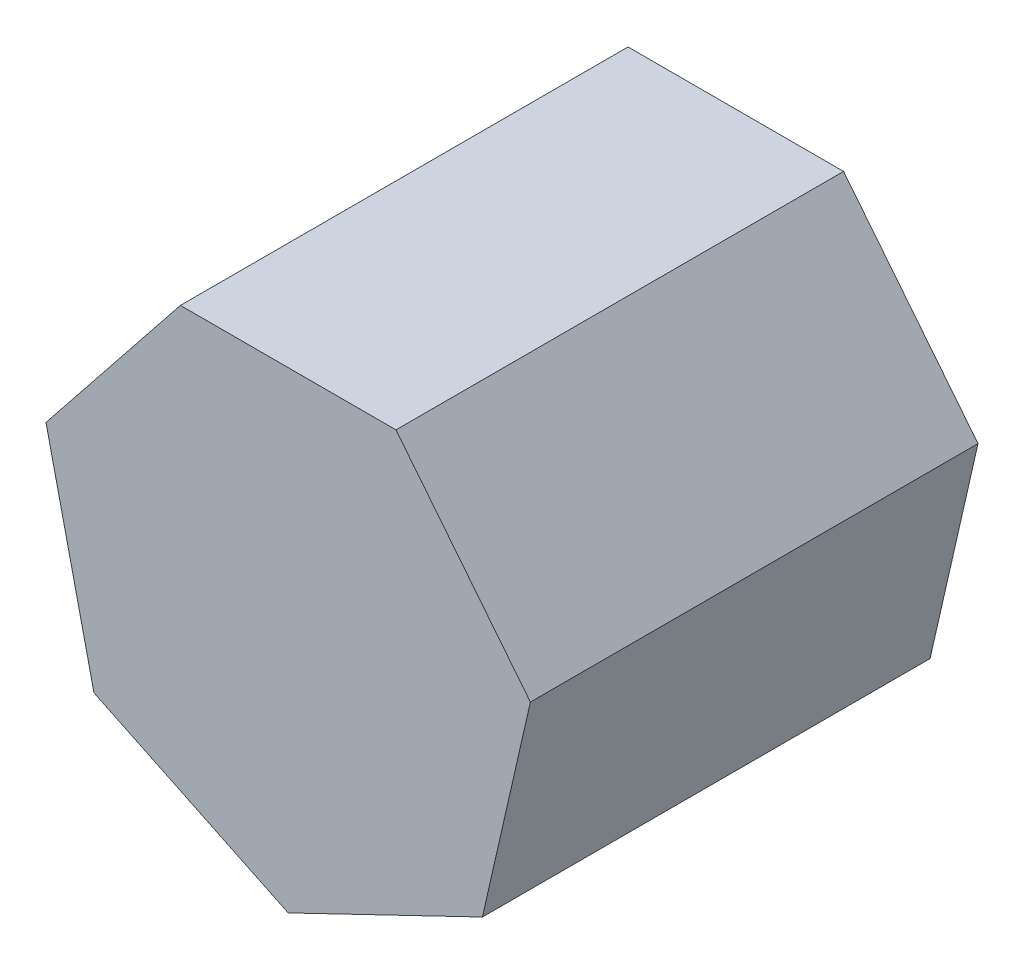
from build123d import *

# Parameters (mm, degrees)
BOSS_EXTRUDE1_DEPTH = 200


with BuildPart() as part:
    # Sketch1 → Boss-Extrude1 (new body)
    with BuildSketch(Plane.XY):
        Polygon((0, -110.991626417), (86.776747824, -69.202147163), (108.208834613, 24.697960372), (48.157461881, 100), (-48.157461881, 100), (-108.208834613, 24.697960372), (-86.776747824, -69.202147163), align=None)
    extrude(amount=BOSS_EXTRUDE1_DEPTH)


solid = part.part
